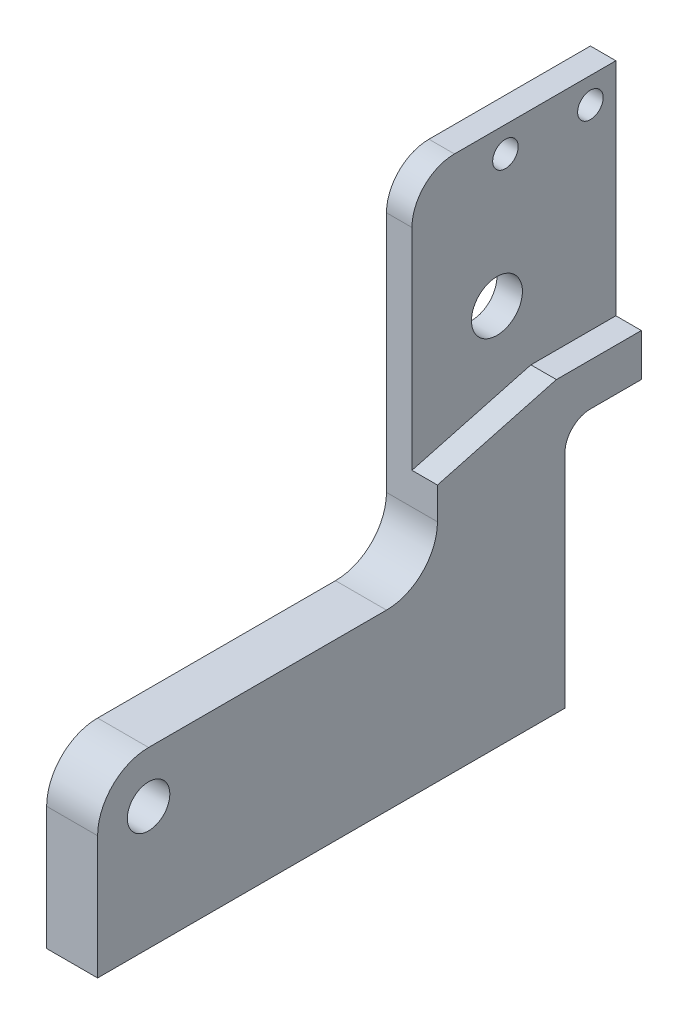
from build123d import *

# Parameters (mm, degrees)
SKETCH1_W                   = 64
SKETCH1_H                   = 60
SKETCH1_R                   = 2.5
SKETCH1_R_2                 = 3
BOSS_EXTRUDE1_DEPTH         = 6
CUT_EXTRUDE2_REACH          = 89.932
SKETCH3_W                   = 9
SKETCH3_H                   = 29
FILLET2_R                   = 3
TAP_DRILL_FOR_M3_TAP1_D     = 2.5
TAP_DRILL_FOR_M3_TAP1_DEPTH = 10
TAP_DRILL_FOR_M3_TAP1_TIP   = 0.751075774
CUT_EXTRUDE3_DEPTH          = 8
CUT_EXTRUDE4_DEPTH          = 3
FILLET3_R                   = 5
CUT_EXTRUDE5_REACH          = 89.778
SKETCH14_R                  = 1.5


with BuildPart() as part:
    # Sketch1 → Boss-Extrude1 (new body)
    with BuildSketch(Plane(origin=(0, 0, 0), x_dir=(0, 0, -1), z_dir=(1, 0, 0))):
        with Locations((32, 30)):
            Rectangle(SKETCH1_W, SKETCH1_H)
        with Locations((6, 14.5)):
            Circle(SKETCH1_R, mode=Mode.SUBTRACT)
        with Locations((50, 42)):
            Circle(SKETCH1_R_2, mode=Mode.SUBTRACT)
    extrude(amount=BOSS_EXTRUDE1_DEPTH)

    # Sketch3 → Cut-Extrude2 (cut, up to next)
    with BuildSketch(Plane(origin=(6, 0, 0), x_dir=(0, 0, -1), z_dir=(1, 0, 0)), mode=Mode.PRIVATE) as cut_extrude2_sk1:
        with Locations((59.5, 14.5)):
            Rectangle(SKETCH3_W, SKETCH3_H)
    cut_extrude2_tool1 = extrude(cut_extrude2_sk1.sketch, amount=-CUT_EXTRUDE2_REACH, mode=Mode.PRIVATE) & part.part
    add(cut_extrude2_tool1.solids().sort_by_distance((6, 14.5, -59.5))[0], mode=Mode.SUBTRACT)

    # Fillet2
    fillet2_edges = [part.edges().sort_by_distance(p)[0] for p in [
        (3, 29, -55),
    ]]
    fillet(fillet2_edges, radius=FILLET2_R)

    # Tap Drill for M3 Tap1
    with Locations(Plane(origin=(0, 0, 0), x_dir=(-1, 0, 0), z_dir=(0, -1, 0))):
        with Locations((-3, 48), (-3, 12)):
            Hole(TAP_DRILL_FOR_M3_TAP1_D / 2, depth=TAP_DRILL_FOR_M3_TAP1_DEPTH)
            with Locations((0, 0, -(TAP_DRILL_FOR_M3_TAP1_DEPTH + TAP_DRILL_FOR_M3_TAP1_TIP / 2))):  # 118° drill point
                Cone(0, TAP_DRILL_FOR_M3_TAP1_D / 2, TAP_DRILL_FOR_M3_TAP1_TIP, mode=Mode.SUBTRACT)

    # Sketch9 → Cut-Extrude3 (cut)
    with BuildSketch(Plane(origin=(6, 0, 0), x_dir=(0, 0, -1), z_dir=(1, 0, 0))):
        with BuildLine():
            Line((6, 20.5), (34, 20.5))
            ThreePointArc((34, 20.5), (38.242640687, 22.257359313), (40, 26.5))
            Line((40, 26.5), (40, 60))
            Line((40, 60), (0, 60))
            Line((0, 60), (0, 14.5))
            ThreePointArc((0, 14.5), (1.757359313, 18.742640687), (6, 20.5))
        make_face()
    extrude(amount=-CUT_EXTRUDE3_DEPTH, mode=Mode.SUBTRACT)

    # Sketch13 → Cut-Extrude4 (cut)
    with BuildSketch(Plane(origin=(6, 0, 0), x_dir=(0, 0, -1), z_dir=(1, 0, 0))):
        Polygon((54, 34), (64, 34), (64, 60), (40, 60), (40, 30.248711306), align=None)
    extrude(amount=-CUT_EXTRUDE4_DEPTH, mode=Mode.SUBTRACT)

    # Fillet3
    fillet3_edges = [part.edges().sort_by_distance(p)[0] for p in [
        (1.5, 60, -40),
    ]]
    fillet(fillet3_edges, radius=FILLET3_R)

    # Sketch14 → Cut-Extrude5 (cut, up to next)
    with BuildSketch(Plane(origin=(3, 0, 0), x_dir=(0, 0, -1), z_dir=(1, 0, 0)), mode=Mode.PRIVATE) as cut_extrude5_sk1:
        with Locations((61, 57)):
            Circle(SKETCH14_R)
    cut_extrude5_tool1 = extrude(cut_extrude5_sk1.sketch, amount=-CUT_EXTRUDE5_REACH, mode=Mode.PRIVATE) & part.part
    # Sketch14 → Cut-Extrude5 (cut, up to next)
    with BuildSketch(Plane(origin=(3, 0, 0), x_dir=(0, 0, -1), z_dir=(1, 0, 0)), mode=Mode.PRIVATE) as cut_extrude5_sk2:
        with Locations((51, 57)):
            Circle(SKETCH14_R)
    cut_extrude5_tool2 = extrude(cut_extrude5_sk2.sketch, amount=-CUT_EXTRUDE5_REACH, mode=Mode.PRIVATE) & part.part
    add(cut_extrude5_tool1.solids().sort_by_distance((3, 57, -61))[0], mode=Mode.SUBTRACT)
    add(cut_extrude5_tool2.solids().sort_by_distance((3, 57, -51))[0], mode=Mode.SUBTRACT)


solid = part.part
